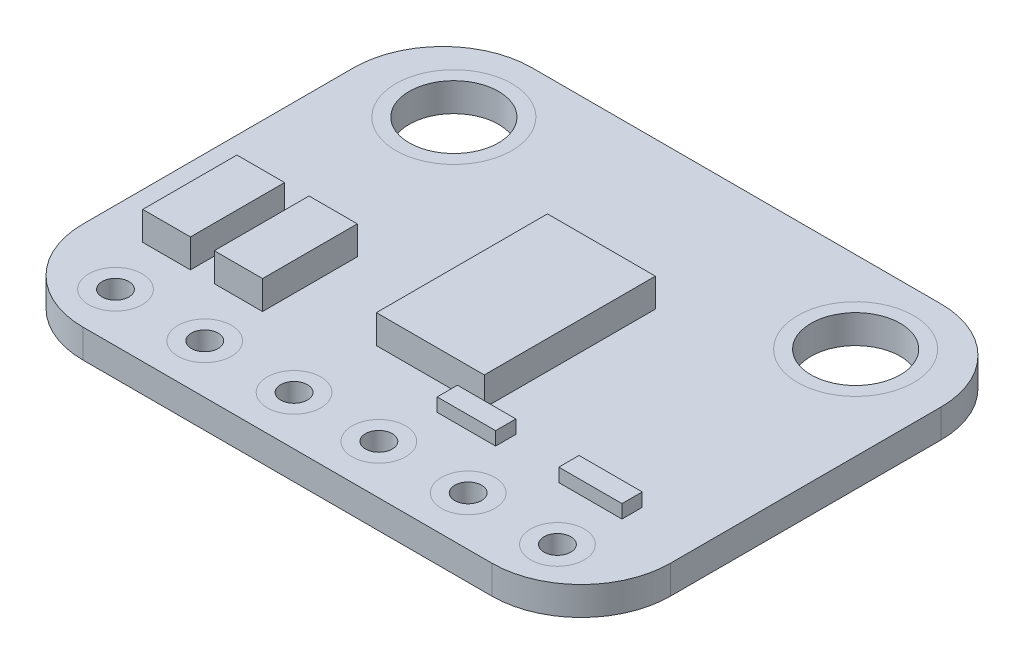
from build123d import *

# Parameters (mm, degrees)
BOSS_EXTRUDE1_DEPTH = 0.8128
SKETCH2_R           = 0.381
SKETCH2_R_2         = 1.27
CUT_EXTRUDE1_DEPTH  = 0.8128
SKETCH4_W           = 3.069128824
SKETCH4_H           = 4.866519185
SKETCH4_W_2         = 1.356521027
SKETCH4_H_2         = 2.679129029
SKETCH4_W_3         = 1.37347754
SKETCH4_H_3         = 2.696085542
BOSS_EXTRUDE2_DEPTH = 0.8128
SKETCH4_3_W         = 1.661738258
SKETCH4_3_H         = 0.576521436
SKETCH4_3_W_2       = 1.797390361
BOSS_EXTRUDE3_DEPTH = 0.381


with BuildPart() as part:
    # Sketch1 → Boss-Extrude1 (new body)
    with BuildSketch(Plane(origin=(0, 0, 0), x_dir=(1, 0, 0), z_dir=(0, 1, 0))):
        with BuildLine():
            Line((5.8166, 6.3881), (-5.8166, 6.3881))
            ThreePointArc((-5.8166, 6.3881), (-7.612651224, 5.644151224), (-8.3566, 3.8481))
            Line((-8.3566, 3.8481), (-8.3566, -3.8481))
            ThreePointArc((-8.3566, -3.8481), (-7.612651224, -5.644151224), (-5.8166, -6.3881))
            Line((-5.8166, -6.3881), (5.8166, -6.3881))
            ThreePointArc((5.8166, -6.3881), (7.612651224, -5.644151224), (8.3566, -3.8481))
            Line((8.3566, -3.8481), (8.3566, 3.8481))
            ThreePointArc((8.3566, 3.8481), (7.612651224, 5.644151224), (5.8166, 6.3881))
        make_face()
    extrude(amount=BOSS_EXTRUDE1_DEPTH)

    # Sketch2 → Cut-Extrude1 (cut)
    with BuildSketch(Plane(origin=(0, 0.8128, 0), x_dir=(1, 0, 0), z_dir=(0, 1, 0))):
        with Locations((-1.2065, -4.993693032)):
            Circle(SKETCH2_R)
        with Locations((-5.715, 4.061084825)):
            Circle(SKETCH2_R_2)
        with Locations((-3.7465, -4.993693032)):
            Circle(SKETCH2_R)
        with Locations((-6.2865, -4.993693032)):
            Circle(SKETCH2_R)
        with Locations((6.2865, -4.993693032)):
            Circle(SKETCH2_R)
        with Locations((3.7465, -4.993693032)):
            Circle(SKETCH2_R)
        with Locations((5.715, 4.061084825)):
            Circle(SKETCH2_R_2)
        with Locations((1.2065, -4.993693032)):
            Circle(SKETCH2_R)
    extrude(amount=-CUT_EXTRUDE1_DEPTH, mode=Mode.SUBTRACT)

    # Sketch4 → Boss-Extrude2 (add)
    with BuildSketch(Plane(origin=(0, 0.8128, 0), x_dir=(1, 0, 0), z_dir=(0, 1, 0))):
        with Locations((0.347608513, -0.237391179)):
            Rectangle(SKETCH4_W, SKETCH4_H)
        with Locations((-6.375648829, -2.111085849)):
            Rectangle(SKETCH4_W_2, SKETCH4_H_2)
        with Locations((-4.332389031, -2.102607592)):
            Rectangle(SKETCH4_W_3, SKETCH4_H_3)
    extrude(amount=BOSS_EXTRUDE2_DEPTH)

    # Sketch4<3> → Boss-Extrude3 (add)
    with BuildSketch(Plane(origin=(0, 0.8128, 0), x_dir=(1, 0, 0), z_dir=(0, 1, 0))):
        with Locations((2.153477131, -3.162389645)):
            Rectangle(SKETCH4_3_W, SKETCH4_3_H)
        with Locations((5.680431802, -3.162389645)):
            Rectangle(SKETCH4_3_W_2, SKETCH4_3_H)
    extrude(amount=BOSS_EXTRUDE3_DEPTH)


solid = part.part
